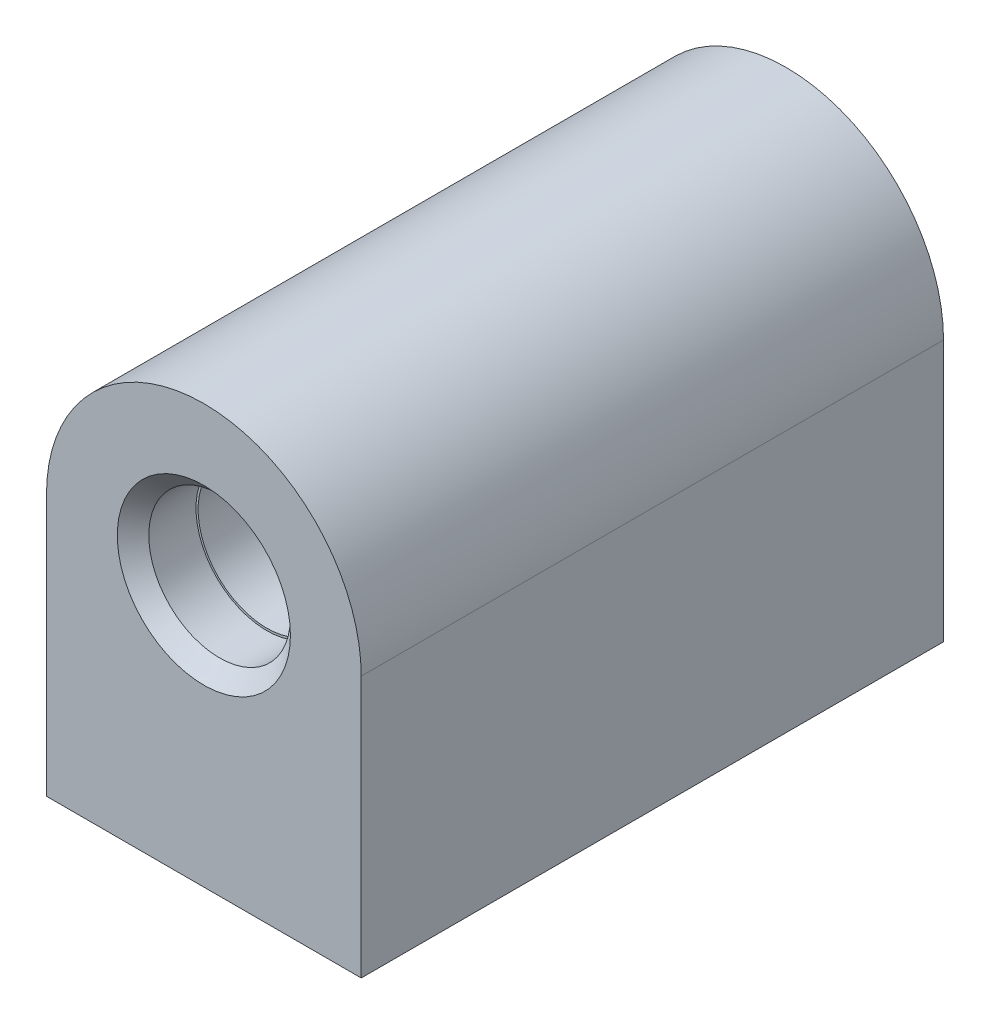
from build123d import *

# Parameters (mm, degrees)
CROQUIS1_R              = 10
CROQUIS1_R_2            = 4.365
SALIENTE_EXTRUIR1_DEPTH = 37
CORTAR_EXTRUIR1_START   = 1
CROQUIS1_3_R            = 8.5
CORTAR_EXTRUIR1_DEPTH   = 5
CORTAR_EXTRUIR2_START   = 7
CROQUIS1_4_R            = 8.5
CORTAR_EXTRUIR2_DEPTH   = 5
CORTAR_EXTRUIR3_START   = 13
CROQUIS1_5_R            = 8.5
CORTAR_EXTRUIR3_DEPTH   = 5
CORTAR_EXTRUIR4_START   = 19
CROQUIS1_6_R            = 8.5
CORTAR_EXTRUIR4_DEPTH   = 5
CORTAR_EXTRUIR5_START   = 25
CROQUIS1_7_R            = 8.5
CORTAR_EXTRUIR5_DEPTH   = 5
CHAFL_N1_SIZE           = 5
CORTAR_EXTRUIR6_START   = 37
CROQUIS4_R              = 4.5
CORTAR_EXTRUIR6_DEPTH   = 4
CHAFL_N2_SIZE           = 1
SALIENTE_EXTRUIR2_DEPTH = 37
CORTAR_EXTRUIR7_START   = -10
CROQUIS6_R              = 3.3
CORTAR_EXTRUIR7_DEPTH   = 116
CORTAR_EXTRUIR8_START   = -12
CORTAR_EXTRUIR8_DEPTH   = 5


with BuildPart() as part:
    # Croquis1 → Saliente-Extruir1 (new body)
    with BuildSketch(Plane.XY):
        Circle(CROQUIS1_R)
        Circle(CROQUIS1_R_2, mode=Mode.SUBTRACT)
    extrude(amount=SALIENTE_EXTRUIR1_DEPTH)

    # Croquis1<3> → Cortar-Extruir1 (cut)
    with BuildSketch(Plane.XY.offset(CORTAR_EXTRUIR1_START)):
        Circle(CROQUIS1_3_R)
    extrude(amount=CORTAR_EXTRUIR1_DEPTH, mode=Mode.SUBTRACT)

    # Croquis1<4> → Cortar-Extruir2 (cut)
    with BuildSketch(Plane.XY.offset(CORTAR_EXTRUIR2_START)):
        Circle(CROQUIS1_4_R)
    extrude(amount=CORTAR_EXTRUIR2_DEPTH, mode=Mode.SUBTRACT)

    # Croquis1<5> → Cortar-Extruir3 (cut)
    with BuildSketch(Plane.XY.offset(CORTAR_EXTRUIR3_START)):
        Circle(CROQUIS1_5_R)
    extrude(amount=CORTAR_EXTRUIR3_DEPTH, mode=Mode.SUBTRACT)

    # Croquis1<6> → Cortar-Extruir4 (cut)
    with BuildSketch(Plane.XY.offset(CORTAR_EXTRUIR4_START)):
        Circle(CROQUIS1_6_R)
    extrude(amount=CORTAR_EXTRUIR4_DEPTH, mode=Mode.SUBTRACT)

    # Croquis1<7> → Cortar-Extruir5 (cut)
    with BuildSketch(Plane.XY.offset(CORTAR_EXTRUIR5_START)):
        Circle(CROQUIS1_7_R)
    extrude(amount=CORTAR_EXTRUIR5_DEPTH, mode=Mode.SUBTRACT)

    # Chaflán1
    # the kernel refuses this chamfer: 5 mm, written as the material it adds along each edge
    with BuildSketch(Plane(origin=(0, 0, 13), x_dir=(1, 0, 0), z_dir=(0, -1, 0))) as chafl_n1_piece_1_section:
        Polygon((8.5 - CHAFL_N1_SIZE, 0), (8.5, CHAFL_N1_SIZE), (8.5, 0), align=None)
    chafl_n1_piece_1 = revolve(axis=Axis((0, 0, 13), (0, 0, 1)), mode=Mode.PRIVATE)
    chafl_n1_piece_1 = chafl_n1_piece_1 - Plane(origin=(0, 0, 15.944314862), x_dir=(1, 0, 0), z_dir=(0, 0, -1)) * Cylinder(4.365, 34, mode=Mode.PRIVATE)
    add(chafl_n1_piece_1)
    with BuildSketch(Plane(origin=(0, 0, 7), x_dir=(1, 0, 0), z_dir=(0, -1, 0))) as chafl_n1_piece_2_section:
        Polygon((8.5 - CHAFL_N1_SIZE, 0), (8.5, CHAFL_N1_SIZE), (8.5, 0), align=None)
    chafl_n1_piece_2 = revolve(axis=Axis((0, 0, 7), (0, 0, 1)), mode=Mode.PRIVATE)
    chafl_n1_piece_2 = chafl_n1_piece_2 - Plane(origin=(0, 0, 9.944314862), x_dir=(1, 0, 0), z_dir=(0, 0, -1)) * Cylinder(4.365, 34, mode=Mode.PRIVATE)
    add(chafl_n1_piece_2)
    with BuildSketch(Plane(origin=(0, 0, 1), x_dir=(1, 0, 0), z_dir=(0, -1, 0))) as chafl_n1_piece_3_section:
        Polygon((8.5 - CHAFL_N1_SIZE, 0), (8.5, CHAFL_N1_SIZE), (8.5, 0), align=None)
    chafl_n1_piece_3 = revolve(axis=Axis((0, 0, 1), (0, 0, 1)), mode=Mode.PRIVATE)
    chafl_n1_piece_3 = chafl_n1_piece_3 - Plane(origin=(0, 0, 3.944314862), x_dir=(1, 0, 0), z_dir=(0, 0, -1)) * Cylinder(4.365, 34, mode=Mode.PRIVATE)
    add(chafl_n1_piece_3)
    with BuildSketch(Plane(origin=(0, 0, 25), x_dir=(1, 0, 0), z_dir=(0, -1, 0))) as chafl_n1_piece_4_section:
        Polygon((8.5, CHAFL_N1_SIZE), (8.5 - CHAFL_N1_SIZE, 0), (8.5, 0), align=None)
    chafl_n1_piece_4 = revolve(axis=Axis((0, 0, 25), (0, 0, 1)), mode=Mode.PRIVATE)
    chafl_n1_piece_4 = chafl_n1_piece_4 - Plane(origin=(0, 0, 27.944314862), x_dir=(1, 0, 0), z_dir=(0, 0, -1)) * Cylinder(4.365, 34, mode=Mode.PRIVATE)
    add(chafl_n1_piece_4)
    with BuildSketch(Plane(origin=(0, 0, 19), x_dir=(1, 0, 0), z_dir=(0, -1, 0))) as chafl_n1_piece_5_section:
        Polygon((8.5, CHAFL_N1_SIZE), (8.5 - CHAFL_N1_SIZE, 0), (8.5, 0), align=None)
    chafl_n1_piece_5 = revolve(axis=Axis((0, 0, 19), (0, 0, 1)), mode=Mode.PRIVATE)
    chafl_n1_piece_5 = chafl_n1_piece_5 - Plane(origin=(0, 0, 21.944314862), x_dir=(1, 0, 0), z_dir=(0, 0, -1)) * Cylinder(4.365, 34, mode=Mode.PRIVATE)
    add(chafl_n1_piece_5)

    # Croquis4 → Cortar-Extruir6 (cut)
    with BuildSketch(Plane.XY.offset(CORTAR_EXTRUIR6_START)):
        Circle(CROQUIS4_R)
    extrude(amount=-CORTAR_EXTRUIR6_DEPTH, mode=Mode.SUBTRACT)

    # Chaflán2
    chafl_n2_edges = [part.edges().sort_by_distance(p)[0] for p in [
        (-4.5, 0, 37),
    ]]
    chamfer(chafl_n2_edges, length=CHAFL_N2_SIZE)

    # Croquis5 → Saliente-Extruir2 (add)
    with BuildSketch(Plane.XY):
        with BuildLine():
            Line((10, -16.611303619), (10, 0))
            ThreePointArc((10, 0), (0, -10), (-10, 0))
            Line((-10, 0), (-10, -16.611303619))
            Line((-10, -16.611303619), (10, -16.611303619))
        make_face()
    extrude(amount=SALIENTE_EXTRUIR2_DEPTH)

    # Croquis6 → Cortar-Extruir7 (cut)
    with BuildSketch(Plane(origin=(0, 0, 0), x_dir=(1, 0, 0), z_dir=(0, 1, 0)).offset(CORTAR_EXTRUIR7_START)):
        with Locations(Location((0, -18.5, 0), (0, 0, 270))):
            Circle(CROQUIS6_R)
    extrude(amount=-CORTAR_EXTRUIR7_DEPTH, mode=Mode.SUBTRACT)

    # Croquis6<3> → Cortar-Extruir8 (cut)
    with BuildSketch(Plane(origin=(0, 0, 0), x_dir=(1, 0, 0), z_dir=(0, 1, 0)).offset(CORTAR_EXTRUIR8_START)):
        Polygon((0, -25.197263123), (5.8, -21.848631561), (5.8, -15.151368439), (0, -11.802736877), (-5.8, -15.151368439), (-5.8, -21.848631561), align=None)
    extrude(amount=-CORTAR_EXTRUIR8_DEPTH, mode=Mode.SUBTRACT)


solid = part.part
